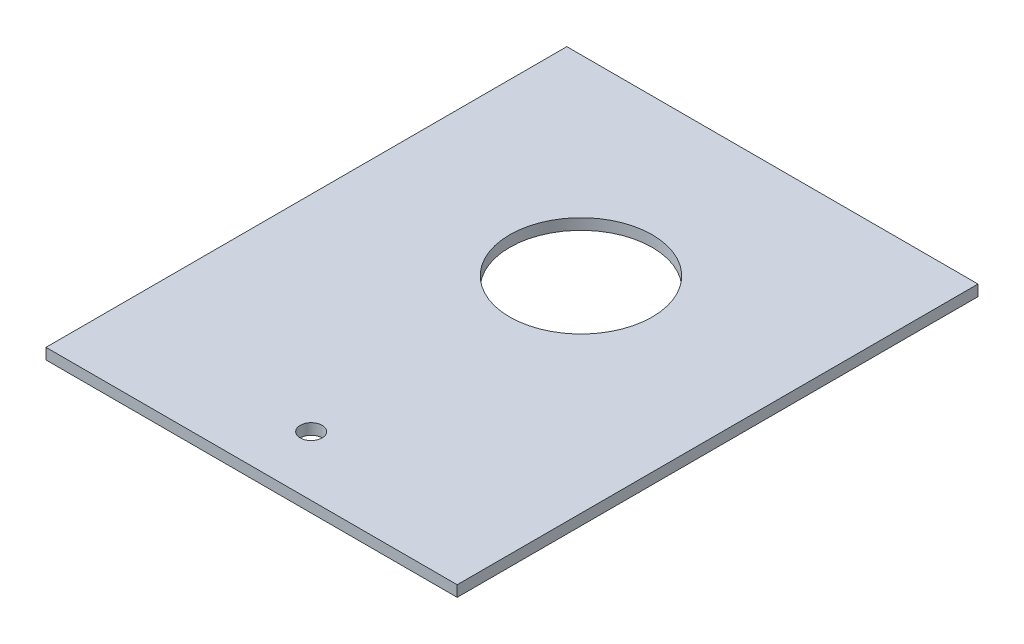
from build123d import *

# Parameters (mm, degrees)
SKETCH1_W           = 150
SKETCH1_H           = 190
BOSS_EXTRUDE1_DEPTH = 4
HOLE1_D             = 52
HOLE1_DEPTH         = 10
HOLE2_D             = 8
HOLE2_DEPTH         = 100


with BuildPart() as part:
    # Sketch1 → Boss-Extrude1 (new body)
    with BuildSketch(Plane(origin=(0, 0, 0), x_dir=(1, 0, 0), z_dir=(0, 1, 0))):
        with Locations((0, -25.157065581)):
            Rectangle(SKETCH1_W, SKETCH1_H)
    extrude(amount=-BOSS_EXTRUDE1_DEPTH)

    # Hole1
    with Locations(Plane(origin=(0, 0, 0), x_dir=(1, 0, 0), z_dir=(0, 1, 0))):
        with Locations((0, 0)):
            Hole(HOLE1_D / 2, depth=HOLE1_DEPTH)

    # Hole2
    with Locations(Plane(origin=(0, 0, 0), x_dir=(1, 0, 0), z_dir=(0, 1, 0))):
        with Locations((0, -98.42)):
            Hole(HOLE2_D / 2, depth=HOLE2_DEPTH)


solid = part.part
